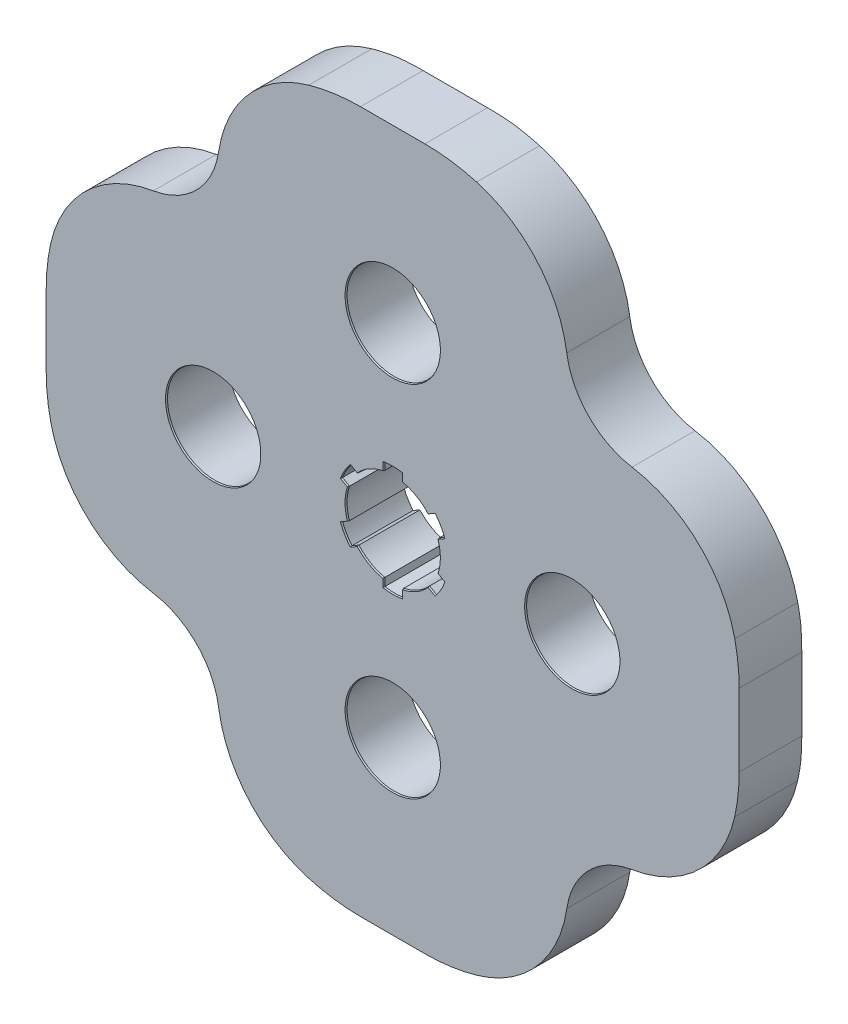
from build123d import *
from OCP.BRepFilletAPI import BRepFilletAPI_MakeChamfer

# Parameters (mm, degrees)
BOSS_EXTRUDE1_DEPTH = 20
CUT_EXTRUDE1_DEPTH  = 35
CHAMFER1_SIZE       = 0.5
CHAMFER1_SIZE2      = 0.133974596
SKETCH3_R           = 15
CUT_EXTRUDE2_DEPTH  = 35
FILLET1_R           = 60
CHAMFER2_SIZE       = 0.5
CHAMFER2_SIZE2      = 0.133974596
SKETCH6_R           = 25
CUT_EXTRUDE3_DEPTH  = 35
CIRPATTERN1_COUNT   = 4
FILLET2_R           = 40


with BuildPart() as part:
    # Sketch1 → Boss-Extrude1 (new body)
    with BuildSketch(Plane.XY):
        Polygon((-110, 36.408742394), (-35.07, 111.338742394), (35.07, 111.338742394), (110, 36.408742394), (110, -36.338742394), (35, -111.338742394), (-35, -111.338742394), (-110, -36.338742394), align=None)
    extrude(amount=BOSS_EXTRUDE1_DEPTH)

    # Sketch2 → Cut-Extrude1 (cut)
    with BuildSketch(Plane.XY.offset(20)):
        with BuildLine():
            Line((3, 14.696938457), (3, 17.24093965))
            ThreePointArc((3, 17.24093965), (0, 17.5), (-3, 17.24093965))
            Line((-3, 17.24093965), (-3, 14.696938457))
            ThreePointArc((-3, 14.696938457), (-7.5, 12.990381057), (-11.227922061, 9.94654544))
            Line((-11.227922061, 9.94654544), (-13.431091722, 11.218546036))
            ThreePointArc((-13.431091722, 11.218546036), (-15.155444566, 8.75), (-16.431091722, 6.022393613))
            Line((-16.431091722, 6.022393613), (-14.227922061, 4.750393017))
            ThreePointArc((-14.227922061, 4.750393017), (-15, 0), (-14.227922061, -4.750393017))
            Line((-14.227922061, -4.750393017), (-16.431091722, -6.022393613))
            ThreePointArc((-16.431091722, -6.022393613), (-15.155444566, -8.75), (-13.431091722, -11.218546036))
            Line((-13.431091722, -11.218546036), (-11.227922061, -9.94654544))
            ThreePointArc((-11.227922061, -9.94654544), (-7.5, -12.990381057), (-3, -14.696938457))
            Line((-3, -14.696938457), (-3, -17.24093965))
            ThreePointArc((-3, -17.24093965), (0, -17.5), (3, -17.24093965))
            Line((3, -17.24093965), (3, -14.696938457))
            ThreePointArc((3, -14.696938457), (7.5, -12.990381057), (11.227922061, -9.94654544))
            Line((11.227922061, -9.94654544), (13.431091722, -11.218546036))
            ThreePointArc((13.431091722, -11.218546036), (15.155444566, -8.75), (16.431091722, -6.022393613))
            Line((16.431091722, -6.022393613), (14.227922061, -4.750393017))
            ThreePointArc((14.227922061, -4.750393017), (15, 0), (14.227922061, 4.750393017))
            Line((14.227922061, 4.750393017), (16.431091722, 6.022393613))
            ThreePointArc((16.431091722, 6.022393613), (15.155444566, 8.75), (13.431091722, 11.218546036))
            Line((13.431091722, 11.218546036), (11.227922061, 9.94654544))
            ThreePointArc((11.227922061, 9.94654544), (7.5, 12.990381057), (3, 14.696938457))
        make_face()
    extrude(amount=-CUT_EXTRUDE1_DEPTH, mode=Mode.SUBTRACT)

    # Chamfer1: one chamfer whose edges measure the first distance from different faces: ONE call of the kernel's chamfer builder (chamfer() names one face for all edges)
    chamfer1_edges_1 = [part.edges().sort_by_distance(p)[0] for p in [
        (-72.5, -73.838742394, 0),
        (-110, 0.035, 0),
        (-72.535, 73.873742394, 0),
        (0, 111.338742394, 0),
        (0, 17.5, 0),
        (-3, 15.968939053, 0),
        (-7.5, 12.990381057, 0),
        (-12.329506891, 10.582545738, 0),
        (-15.155444566, 8.75, 0),
        (-15.329506891, 5.386393315, 0),
        (-15, 0, 0),
        (-15.329506891, -5.386393315, 0),
        (-15.155444566, -8.75, 0),
        (-12.329506891, -10.582545738, 0),
        (-7.5, -12.990381057, 0),
        (-3, -15.968939053, 0),
        (0, -17.5, 0),
        (3, -15.968939053, 0),
        (7.5, -12.990381057, 0),
        (12.329506891, -10.582545738, 0),
        (15.155444566, -8.75, 0),
        (15.329506891, -5.386393315, 0),
        (15, 0, 0),
        (15.329506891, 5.386393315, 0),
        (15.155444566, 8.75, 0),
        (12.329506891, 10.582545738, 0),
        (7.5, 12.990381057, 0),
        (3, 15.968939053, 0),
        (72.535, 73.873742394, 0),
        (110, 0.035, 0),
        (72.5, -73.838742394, 0),
        (0, -111.338742394, 0),
    ]]
    chamfer1_side_1 = [part.faces().sort_by_distance(p)[0] for p in [
        (-70.32157209, 71.660314484, 0),
    ]]
    chamfer1_edges_2 = [part.edges().sort_by_distance(p)[0] for p in [
        (3, 15.968939053, 20),
    ]]
    chamfer1_side_2 = [part.faces().sort_by_distance(p)[0] for p in [
        (3, 15.968939053, 10),
    ]]
    chamfer1_edges_3 = [part.edges().sort_by_distance(p)[0] for p in [
        (15.329506891, 5.386393315, 20),
    ]]
    chamfer1_side_3 = [part.faces().sort_by_distance(p)[0] for p in [
        (15.329506891, 5.386393315, 10),
    ]]
    chamfer1_edges_4 = [part.edges().sort_by_distance(p)[0] for p in [
        (12.329506891, -10.582545738, 20),
    ]]
    chamfer1_side_4 = [part.faces().sort_by_distance(p)[0] for p in [
        (12.329506891, -10.582545738, 10),
    ]]
    chamfer1_edges_5 = [part.edges().sort_by_distance(p)[0] for p in [
        (-3, -15.968939053, 20),
    ]]
    chamfer1_side_5 = [part.faces().sort_by_distance(p)[0] for p in [
        (-3, -15.968939053, 10),
    ]]
    chamfer1_edges_6 = [part.edges().sort_by_distance(p)[0] for p in [
        (-15.329506891, -5.386393315, 20),
    ]]
    chamfer1_side_6 = [part.faces().sort_by_distance(p)[0] for p in [
        (-15.329506891, -5.386393315, 10),
    ]]
    chamfer1_edges_7 = [part.edges().sort_by_distance(p)[0] for p in [
        (-12.329506891, 10.582545738, 20),
    ]]
    chamfer1_side_7 = [part.faces().sort_by_distance(p)[0] for p in [
        (-12.329506891, 10.582545738, 10),
    ]]
    chamfer1_edges_8 = [part.edges().sort_by_distance(p)[0] for p in [
        (0, 17.5, 20),
    ]]
    chamfer1_side_8 = [part.faces().sort_by_distance(p)[0] for p in [
        (0, 17.5, 10),
    ]]
    chamfer1_edges_9 = [part.edges().sort_by_distance(p)[0] for p in [
        (-3, 15.968939053, 20),
    ]]
    chamfer1_side_9 = [part.faces().sort_by_distance(p)[0] for p in [
        (-3, 15.968939053, 10),
    ]]
    chamfer1_edges_10 = [part.edges().sort_by_distance(p)[0] for p in [
        (-7.5, 12.990381057, 20),
    ]]
    chamfer1_side_10 = [part.faces().sort_by_distance(p)[0] for p in [
        (-7.5, 12.990381057, 10),
    ]]
    chamfer1_edges_11 = [part.edges().sort_by_distance(p)[0] for p in [
        (-15.155444566, 8.75, 20),
    ]]
    chamfer1_side_11 = [part.faces().sort_by_distance(p)[0] for p in [
        (-15.155444566, 8.75, 10),
    ]]
    chamfer1_edges_12 = [part.edges().sort_by_distance(p)[0] for p in [
        (-15.329506891, 5.386393315, 20),
    ]]
    chamfer1_side_12 = [part.faces().sort_by_distance(p)[0] for p in [
        (-15.329506891, 5.386393315, 10),
    ]]
    chamfer1_edges_13 = [part.edges().sort_by_distance(p)[0] for p in [
        (-15, 0, 20),
    ]]
    chamfer1_side_13 = [part.faces().sort_by_distance(p)[0] for p in [
        (-15, 0, 10),
    ]]
    chamfer1_edges_14 = [part.edges().sort_by_distance(p)[0] for p in [
        (-15.155444566, -8.75, 20),
    ]]
    chamfer1_side_14 = [part.faces().sort_by_distance(p)[0] for p in [
        (-15.155444566, -8.75, 10),
    ]]
    chamfer1_edges_15 = [part.edges().sort_by_distance(p)[0] for p in [
        (-12.329506891, -10.582545738, 20),
    ]]
    chamfer1_side_15 = [part.faces().sort_by_distance(p)[0] for p in [
        (-12.329506891, -10.582545738, 10),
    ]]
    chamfer1_edges_16 = [part.edges().sort_by_distance(p)[0] for p in [
        (-7.5, -12.990381057, 20),
    ]]
    chamfer1_side_16 = [part.faces().sort_by_distance(p)[0] for p in [
        (-7.5, -12.990381057, 10),
    ]]
    chamfer1_edges_17 = [part.edges().sort_by_distance(p)[0] for p in [
        (0, -17.5, 20),
    ]]
    chamfer1_side_17 = [part.faces().sort_by_distance(p)[0] for p in [
        (0, -17.5, 10),
    ]]
    chamfer1_edges_18 = [part.edges().sort_by_distance(p)[0] for p in [
        (3, -15.968939053, 20),
    ]]
    chamfer1_side_18 = [part.faces().sort_by_distance(p)[0] for p in [
        (3, -15.968939053, 10),
    ]]
    chamfer1_edges_19 = [part.edges().sort_by_distance(p)[0] for p in [
        (7.5, -12.990381057, 20),
    ]]
    chamfer1_side_19 = [part.faces().sort_by_distance(p)[0] for p in [
        (7.5, -12.990381057, 10),
    ]]
    chamfer1_edges_20 = [part.edges().sort_by_distance(p)[0] for p in [
        (15.155444566, -8.75, 20),
    ]]
    chamfer1_side_20 = [part.faces().sort_by_distance(p)[0] for p in [
        (15.155444566, -8.75, 10),
    ]]
    chamfer1_edges_21 = [part.edges().sort_by_distance(p)[0] for p in [
        (15.329506891, -5.386393315, 20),
    ]]
    chamfer1_side_21 = [part.faces().sort_by_distance(p)[0] for p in [
        (15.329506891, -5.386393315, 10),
    ]]
    chamfer1_edges_22 = [part.edges().sort_by_distance(p)[0] for p in [
        (15, 0, 20),
    ]]
    chamfer1_side_22 = [part.faces().sort_by_distance(p)[0] for p in [
        (15, 0, 10),
    ]]
    chamfer1_edges_23 = [part.edges().sort_by_distance(p)[0] for p in [
        (15.155444566, 8.75, 20),
    ]]
    chamfer1_side_23 = [part.faces().sort_by_distance(p)[0] for p in [
        (15.155444566, 8.75, 10),
    ]]
    chamfer1_edges_24 = [part.edges().sort_by_distance(p)[0] for p in [
        (12.329506891, 10.582545738, 20),
    ]]
    chamfer1_side_24 = [part.faces().sort_by_distance(p)[0] for p in [
        (12.329506891, 10.582545738, 10),
    ]]
    chamfer1_edges_25 = [part.edges().sort_by_distance(p)[0] for p in [
        (7.5, 12.990381057, 20),
    ]]
    chamfer1_side_25 = [part.faces().sort_by_distance(p)[0] for p in [
        (7.5, 12.990381057, 10),
    ]]
    chamfer1 = BRepFilletAPI_MakeChamfer(part.part.solid().wrapped)
    for e in chamfer1_edges_1:
        chamfer1.Add(CHAMFER1_SIZE, CHAMFER1_SIZE2, e.wrapped, chamfer1_side_1[0].wrapped)  # the first distance lies on this face
    for e in chamfer1_edges_2:
        chamfer1.Add(CHAMFER1_SIZE, CHAMFER1_SIZE2, e.wrapped, chamfer1_side_2[0].wrapped)  # the first distance lies on this face
    for e in chamfer1_edges_3:
        chamfer1.Add(CHAMFER1_SIZE, CHAMFER1_SIZE2, e.wrapped, chamfer1_side_3[0].wrapped)  # the first distance lies on this face
    for e in chamfer1_edges_4:
        chamfer1.Add(CHAMFER1_SIZE, CHAMFER1_SIZE2, e.wrapped, chamfer1_side_4[0].wrapped)  # the first distance lies on this face
    for e in chamfer1_edges_5:
        chamfer1.Add(CHAMFER1_SIZE, CHAMFER1_SIZE2, e.wrapped, chamfer1_side_5[0].wrapped)  # the first distance lies on this face
    for e in chamfer1_edges_6:
        chamfer1.Add(CHAMFER1_SIZE, CHAMFER1_SIZE2, e.wrapped, chamfer1_side_6[0].wrapped)  # the first distance lies on this face
    for e in chamfer1_edges_7:
        chamfer1.Add(CHAMFER1_SIZE, CHAMFER1_SIZE2, e.wrapped, chamfer1_side_7[0].wrapped)  # the first distance lies on this face
    for e in chamfer1_edges_8:
        chamfer1.Add(CHAMFER1_SIZE, CHAMFER1_SIZE2, e.wrapped, chamfer1_side_8[0].wrapped)  # the first distance lies on this face
    for e in chamfer1_edges_9:
        chamfer1.Add(CHAMFER1_SIZE, CHAMFER1_SIZE2, e.wrapped, chamfer1_side_9[0].wrapped)  # the first distance lies on this face
    for e in chamfer1_edges_10:
        chamfer1.Add(CHAMFER1_SIZE, CHAMFER1_SIZE2, e.wrapped, chamfer1_side_10[0].wrapped)  # the first distance lies on this face
    for e in chamfer1_edges_11:
        chamfer1.Add(CHAMFER1_SIZE, CHAMFER1_SIZE2, e.wrapped, chamfer1_side_11[0].wrapped)  # the first distance lies on this face
    for e in chamfer1_edges_12:
        chamfer1.Add(CHAMFER1_SIZE, CHAMFER1_SIZE2, e.wrapped, chamfer1_side_12[0].wrapped)  # the first distance lies on this face
    for e in chamfer1_edges_13:
        chamfer1.Add(CHAMFER1_SIZE, CHAMFER1_SIZE2, e.wrapped, chamfer1_side_13[0].wrapped)  # the first distance lies on this face
    for e in chamfer1_edges_14:
        chamfer1.Add(CHAMFER1_SIZE, CHAMFER1_SIZE2, e.wrapped, chamfer1_side_14[0].wrapped)  # the first distance lies on this face
    for e in chamfer1_edges_15:
        chamfer1.Add(CHAMFER1_SIZE, CHAMFER1_SIZE2, e.wrapped, chamfer1_side_15[0].wrapped)  # the first distance lies on this face
    for e in chamfer1_edges_16:
        chamfer1.Add(CHAMFER1_SIZE, CHAMFER1_SIZE2, e.wrapped, chamfer1_side_16[0].wrapped)  # the first distance lies on this face
    for e in chamfer1_edges_17:
        chamfer1.Add(CHAMFER1_SIZE, CHAMFER1_SIZE2, e.wrapped, chamfer1_side_17[0].wrapped)  # the first distance lies on this face
    for e in chamfer1_edges_18:
        chamfer1.Add(CHAMFER1_SIZE, CHAMFER1_SIZE2, e.wrapped, chamfer1_side_18[0].wrapped)  # the first distance lies on this face
    for e in chamfer1_edges_19:
        chamfer1.Add(CHAMFER1_SIZE, CHAMFER1_SIZE2, e.wrapped, chamfer1_side_19[0].wrapped)  # the first distance lies on this face
    for e in chamfer1_edges_20:
        chamfer1.Add(CHAMFER1_SIZE, CHAMFER1_SIZE2, e.wrapped, chamfer1_side_20[0].wrapped)  # the first distance lies on this face
    for e in chamfer1_edges_21:
        chamfer1.Add(CHAMFER1_SIZE, CHAMFER1_SIZE2, e.wrapped, chamfer1_side_21[0].wrapped)  # the first distance lies on this face
    for e in chamfer1_edges_22:
        chamfer1.Add(CHAMFER1_SIZE, CHAMFER1_SIZE2, e.wrapped, chamfer1_side_22[0].wrapped)  # the first distance lies on this face
    for e in chamfer1_edges_23:
        chamfer1.Add(CHAMFER1_SIZE, CHAMFER1_SIZE2, e.wrapped, chamfer1_side_23[0].wrapped)  # the first distance lies on this face
    for e in chamfer1_edges_24:
        chamfer1.Add(CHAMFER1_SIZE, CHAMFER1_SIZE2, e.wrapped, chamfer1_side_24[0].wrapped)  # the first distance lies on this face
    for e in chamfer1_edges_25:
        chamfer1.Add(CHAMFER1_SIZE, CHAMFER1_SIZE2, e.wrapped, chamfer1_side_25[0].wrapped)  # the first distance lies on this face
    add(Compound.cast(chamfer1.Shape()), mode=Mode.REPLACE)

    # Sketch3 → Cut-Extrude2 (cut)
    with BuildSketch(Plane(origin=(0, 0, 0), x_dir=(-1, 0, 0), z_dir=(0, 0, -1))):
        with Locations((0, 57)):
            Circle(SKETCH3_R)
        with Locations((-57, 0)):
            Circle(SKETCH3_R)
        with Locations((57, 0)):
            Circle(SKETCH3_R)
        with Locations((0, -57)):
            Circle(SKETCH3_R)
    extrude(amount=-CUT_EXTRUDE2_DEPTH, mode=Mode.SUBTRACT)

    # Fillet1
    # the kernel refuses this fillet: 60 mm, written as the material it takes off along each edge
    with BuildSketch(Plane(origin=(-110, 36.408742394, -61.99805976), x_dir=(0.7071067811865475, 0.7071067811865477, 0), z_dir=(0, 0, 1)), Plane(origin=(-110, -36.338742394, -61.99805976), x_dir=(0, 1, 0), z_dir=(0, 0, 1)), Plane(origin=(-35, -111.338742394, -61.99805976), x_dir=(-0.7071067811865472, 0.7071067811865478, 0), z_dir=(0, 0, 1)), Plane(origin=(35, -111.338742394, -61.99805976), x_dir=(-1, 0, 0), z_dir=(0, 0, 1))) as fillet1_piece_1:
        with BuildLine():
            CenterArc((FILLET1_R * 0.414213562373, -FILLET1_R), FILLET1_R, 90, 45)
            Line((-FILLET1_R * 0.292893218813, -FILLET1_R * 0.292893218813), (0, 0))
            Line((0, 0), (FILLET1_R * 0.414213562373, 0))
        make_face()
    extrude(amount=144.130094116, mode=Mode.SUBTRACT)
    with BuildSketch(Plane(origin=(110, -36.338742394, -61.99805976), x_dir=(0, 1, 0), z_dir=(0, 0, 1)), Plane(origin=(110, 36.408742394, -61.99805976), x_dir=(-0.7071067811865475, 0.7071067811865475, 0), z_dir=(0, 0, 1)), Plane(origin=(35.07, 111.338742394, -61.99805976), x_dir=(-1, 0, 0), z_dir=(0, 0, 1)), Plane(origin=(-35.07, 111.338742394, -61.99805976), x_dir=(-0.7071067811865476, -0.7071067811865476, 0), z_dir=(0, 0, 1))) as fillet1_piece_2:
        with BuildLine():
            CenterArc((FILLET1_R * 0.414213562373, FILLET1_R), FILLET1_R, 225, 45)
            Line((-FILLET1_R * 0.292893218813, FILLET1_R * 0.292893218813), (0, 0))
            Line((0, 0), (FILLET1_R * 0.414213562373, 0))
        make_face()
    extrude(amount=144.130094116, mode=Mode.SUBTRACT)

    # Chamfer2: one chamfer whose edges measure the first distance from different faces: ONE call of the kernel's chamfer builder (chamfer() names one face for all edges)
    chamfer2_edges_1 = [part.edges().sort_by_distance(p)[0] for p in [
        (15, 57, 20),
    ]]
    chamfer2_side_1 = [part.faces().sort_by_distance(p)[0] for p in [
        (15, 57, 10),
    ]]
    chamfer2_edges_2 = [part.edges().sort_by_distance(p)[0] for p in [
        (15, 57, 0),
        (72, 0, 0),
        (-42, 0, 0),
        (15, -57, 0),
    ]]
    chamfer2_side_2 = [part.faces().sort_by_distance(p)[0] for p in [
        (0, -107.7226245, 0),
    ]]
    chamfer2_edges_3 = [part.edges().sort_by_distance(p)[0] for p in [
        (72, 0, 20),
    ]]
    chamfer2_side_3 = [part.faces().sort_by_distance(p)[0] for p in [
        (72, 0, 10),
    ]]
    chamfer2_edges_4 = [part.edges().sort_by_distance(p)[0] for p in [
        (-42, 0, 20),
    ]]
    chamfer2_side_4 = [part.faces().sort_by_distance(p)[0] for p in [
        (-42, 0, 10),
    ]]
    chamfer2_edges_5 = [part.edges().sort_by_distance(p)[0] for p in [
        (15, -57, 20),
    ]]
    chamfer2_side_5 = [part.faces().sort_by_distance(p)[0] for p in [
        (15, -57, 10),
    ]]
    chamfer2 = BRepFilletAPI_MakeChamfer(part.part.solid().wrapped)
    for e in chamfer2_edges_1:
        chamfer2.Add(CHAMFER2_SIZE, CHAMFER2_SIZE2, e.wrapped, chamfer2_side_1[0].wrapped)  # the first distance lies on this face
    for e in chamfer2_edges_2:
        chamfer2.Add(CHAMFER2_SIZE, CHAMFER2_SIZE2, e.wrapped, chamfer2_side_2[0].wrapped)  # the first distance lies on this face
    for e in chamfer2_edges_3:
        chamfer2.Add(CHAMFER2_SIZE, CHAMFER2_SIZE2, e.wrapped, chamfer2_side_3[0].wrapped)  # the first distance lies on this face
    for e in chamfer2_edges_4:
        chamfer2.Add(CHAMFER2_SIZE, CHAMFER2_SIZE2, e.wrapped, chamfer2_side_4[0].wrapped)  # the first distance lies on this face
    for e in chamfer2_edges_5:
        chamfer2.Add(CHAMFER2_SIZE, CHAMFER2_SIZE2, e.wrapped, chamfer2_side_5[0].wrapped)  # the first distance lies on this face
    add(Compound.cast(chamfer2.Shape()), mode=Mode.REPLACE)

    # Sketch6 → Cut-Extrude3 (cut)
    with BuildSketch(Plane.XY.offset(20)):
        with Locations((80, 80.01)):
            Circle(SKETCH6_R)
    cut_extrude3 = extrude(amount=-CUT_EXTRUDE3_DEPTH, mode=Mode.SUBTRACT)

    # CirPattern1: Cut-Extrude3 ×4 about axis
    cirpattern1_axis = Axis((0, 0, 0), (0, 0, 1))
    for i in range(1, CIRPATTERN1_COUNT):
        add(cut_extrude3.rotate(cirpattern1_axis, i * 360 / CIRPATTERN1_COUNT), mode=Mode.SUBTRACT)

    # Fillet2
    fillet2_edges = [part.edges().sort_by_distance(p)[0] for p in [
        (89.476953166, -56.861789228, 10.066987298),
        (56.871789228, -89.466953166, 10.066987298),
        (-56.861789228, -89.476953166, 10.066987298),
        (-89.466953166, -56.871789228, 10.066987298),
        (-89.526584436, 56.882157958, 10.066987298),
        (-56.892157958, 89.516584436, 10.066987298),
        (56.882157958, 89.526584436, 10.066987298),
        (89.516584436, 56.892157958, 10.066987298),
    ]]
    fillet(fillet2_edges, radius=FILLET2_R)


solid = part.part
